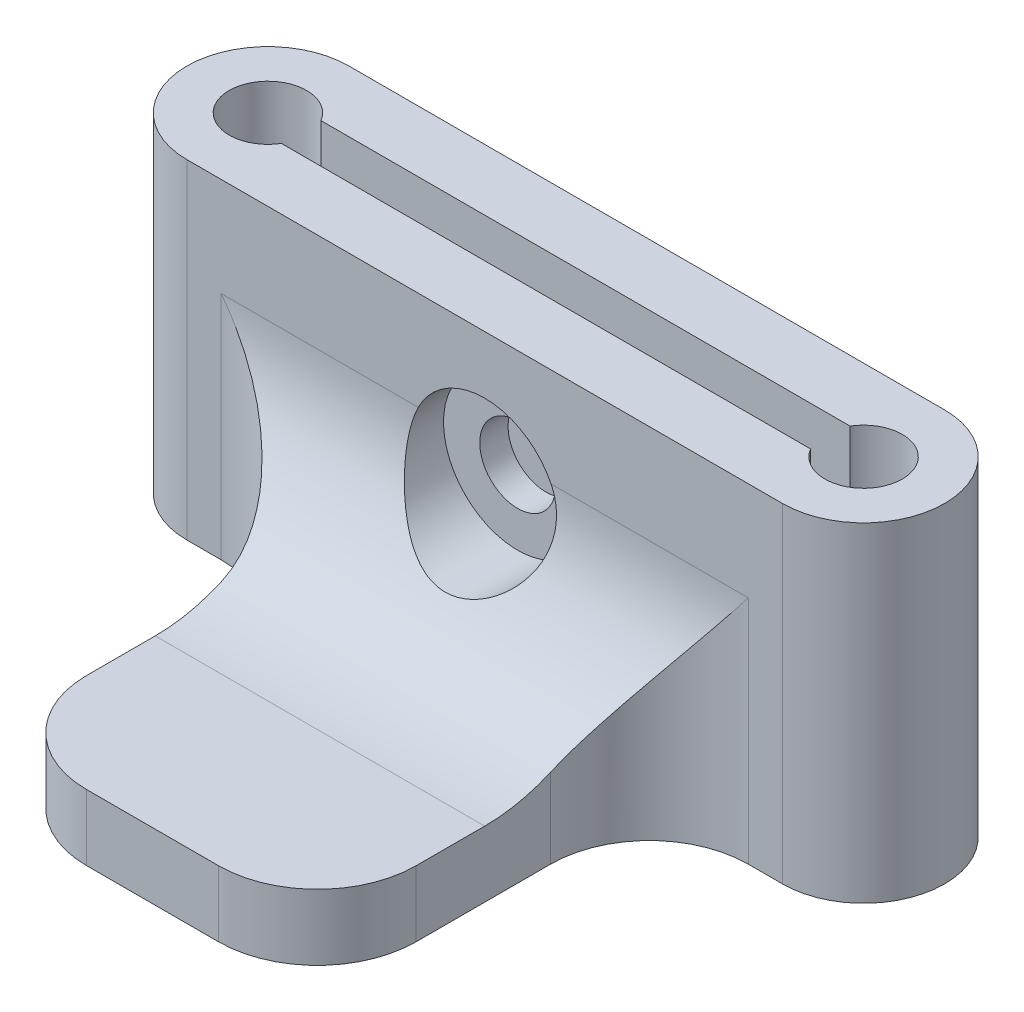
from build123d import *

# Parameters (mm, degrees)
SKETCH_1_R               = 1.175
EXTRUDE_1_DEPTH          = 10
SKETCH_3_W               = 10
SKETCH_3_H               = 15
EXTRUDE_2_DEPTH          = 2
FILLET_2_R               = 3
FILLET_START             = -5
FILLET_3_DEPTH           = 10
FILLET_START_2           = 2
FILLET_3_2_DEPTH         = 4.9438
FILLET_START_3           = -9
FILLET_3_3_DEPTH         = 17
SKETCH_4_W               = 16.05948
SKETCH_4_H               = 1.2
CUT_EXTRUDE_2_DEPTH      = 20.735795
CUT_EXTRUDE_4_DEPTH      = 19.271738
CUT_EXTRUDE_4_DEPTH_BACK = 1
SKETCH_6_R               = 2.25
SKETCH_7_R               = 1.15
CUT_EXTRUDE_5_DEPTH      = 19.841879
CUT_EXTRUDE_6_DEPTH      = 1


with BuildPart() as part:
    # 草图1 → 凸台-拉伸1 (new body)
    with BuildSketch(Plane(origin=(0, 0, 0), x_dir=(1, 0, 0), z_dir=(0, 1, 0))):
        with BuildLine():
            Line((-9.04, 2.46), (9.04, 2.46))
            ThreePointArc((9.04, 2.46), (11.5, 0), (9.04, -2.46))
            Line((9.04, -2.46), (-9.04, -2.46))
            ThreePointArc((-9.04, -2.46), (-11.5, 0), (-9.04, 2.46))
        make_face()
        with Locations(Location((9.04, 0, 0), (0, 0, 270))):
            Circle(SKETCH_1_R, mode=Mode.SUBTRACT)
        with Locations(Location((-9.04, 0, 0), (0, 0, 90))):
            Circle(SKETCH_1_R, mode=Mode.SUBTRACT)
    extrude(amount=EXTRUDE_1_DEPTH)

    # 草图3 → 凸台-拉伸2 (add)
    with BuildSketch(Plane.XZ):
        with Locations((0, 5.04)):
            Rectangle(SKETCH_3_W, SKETCH_3_H)
    extrude(amount=-EXTRUDE_2_DEPTH)

    # 圆角2
    fillet_2_edges = [part.edges().sort_by_distance(p)[0] for p in [
        (5, 1, 12.54),
        (5, 1, 2.46),
        (-5, 1, 2.46),
        (-5, 1, 12.54),
    ]]
    fillet(fillet_2_edges, radius=FILLET_2_R)

    # 圆角3: read off the stored shape, not the designer's step
    # 圆角3 outline → 圆角3 (add)
    with BuildSketch(Plane.YZ.offset(FILLET_START)):
        with BuildLine():
            ThreePointArc((7, 2.46), (3.464466, 3.924466), (2, 7.46))
            Line((2, 7.46), (2, 2.46))
            Line((2, 2.46), (7, 2.46))
        make_face()
    extrude(amount=FILLET_3_DEPTH)

    # Fillet 3 2 outline → Fillet 3 2 (add)
    with BuildSketch(Plane(origin=(0, 0, 0), x_dir=(1, 0, 0), z_dir=(0, 1, 0)).offset(FILLET_START_2)):
        with BuildLine():
            Line((5, -2.46), (5, -5.46))
            ThreePointArc((5, -5.46), (5.87868, -3.33868), (8, -2.46))
            Line((8, -2.46), (5, -2.46))
        make_face()
        with BuildLine():
            Line((-5, -5.46), (-5, -2.46))
            Line((-5, -2.46), (-8, -2.46))
            ThreePointArc((-8, -2.46), (-5.87868, -3.33868), (-5, -5.46))
        make_face()
    extrude(amount=FILLET_3_2_DEPTH)

    # Fillet 3 3 outline → Fillet 3 3 (cut)
    with BuildSketch(Plane.YZ.offset(FILLET_START_3)):
        with BuildLine():
            Line((8, 7), (2.021205, 7))
            ThreePointArc((2.021205, 7), (3.610313, 3.784402), (6.9438, 2.460316))
            ThreePointArc((6.9438, 2.460316), (6.9719, 2.460079), (7, 2.46))
            Line((7, 2.46), (8, 2.46))
            Line((8, 2.46), (8, 7))
        make_face()
    extrude(amount=FILLET_3_3_DEPTH, mode=Mode.SUBTRACT)

    # 草图4 → 切除-拉伸2 (cut, through all)
    with BuildSketch(Plane.XZ):
        Rectangle(SKETCH_4_W, SKETCH_4_H)
    extrude(amount=-CUT_EXTRUDE_2_DEPTH, mode=Mode.SUBTRACT)

    # 草图6 → 切除-拉伸4 (cut, two sides: drawn at the far end of the back side and taken through both)
    with BuildSketch(Plane.XY.offset(2.46).offset(-CUT_EXTRUDE_4_DEPTH_BACK)):
        with Locations(Location((0, 6, 0), (0, 0, 153.6122))):
            Circle(SKETCH_6_R)
    extrude(amount=CUT_EXTRUDE_4_DEPTH + CUT_EXTRUDE_4_DEPTH_BACK, mode=Mode.SUBTRACT)

    # 草图7 → 切除-拉伸5 (cut, through all)
    with BuildSketch(Plane.XY.offset(1.46)):
        with Locations((0, 6)):
            Circle(SKETCH_7_R)
    extrude(amount=-CUT_EXTRUDE_5_DEPTH, mode=Mode.SUBTRACT)

    # 草图8 → 切除-拉伸6 (cut)
    with BuildSketch(Plane(origin=(0, 0, -2.46), x_dir=(-1, 0, 0), z_dir=(0, 0, -1))):
        Polygon((0, 8.424871), (-2.1, 7.212436), (-2.1, 4.787564), (0, 3.575129), (2.1, 4.787564), (2.1, 7.212436), align=None)
    extrude(amount=-CUT_EXTRUDE_6_DEPTH, mode=Mode.SUBTRACT)


solid = part.part
